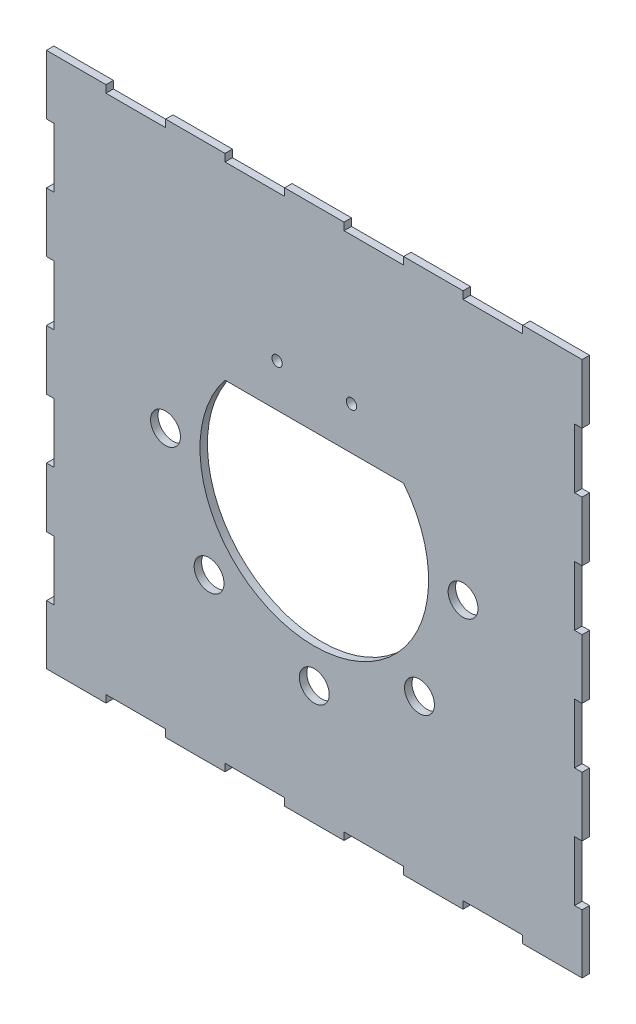
from build123d import *

# Parameters (mm, degrees)
SKETCH1_W           = 114.3
SKETCH1_H           = 114.3
BOSS_EXTRUDE1_DEPTH = 1.5875
CUT_EXTRUDE1_DEPTH  = 81.837894309
SKETCH4_R           = 3.1877
CUT_EXTRUDE2_DEPTH  = 81.837894309
SKETCH6_W           = 1.59004
SKETCH6_H           = 12.7254
SKETCH6_W_2         = 12.7254
SKETCH6_H_2         = 1.59004
CUT_EXTRUDE5_DEPTH  = 81.837894309
SKETCH7_OUTSIDE_W   = 148.63
SKETCH7_OUTSIDE_H   = 148.63
SKETCH7_OUTSIDE_R   = 1.1049
CUT_EXTRUDE6_DEPTH  = 81.837894309


with BuildPart() as part:
    # Sketch1 → Boss-Extrude1 (new body)
    with BuildSketch(Plane.XY):
        Rectangle(SKETCH1_W, SKETCH1_H)
    extrude(amount=BOSS_EXTRUDE1_DEPTH)

    # Sketch2 → Cut-Extrude1 (cut, through all)
    with BuildSketch(Plane.XY.offset(1.5875)):
        with BuildLine():
            Line((-19.05, 15.24), (19.05, 15.24))
            ThreePointArc((19.05, 15.24), (0, -24.395903345), (-19.05, 15.24))
        make_face()
    extrude(amount=-CUT_EXTRUDE1_DEPTH, mode=Mode.SUBTRACT)

    # Sketch4 → Cut-Extrude2 (cut, through all)
    with BuildSketch(Plane.XY.offset(1.5875)):
        with Locations((-31.75, 0)):
            Circle(SKETCH4_R)
        with Locations((-22.450640303, -22.450640303)):
            Circle(SKETCH4_R)
        with Locations((0, -31.75)):
            Circle(SKETCH4_R)
        with Locations((22.450640303, -22.450640303)):
            Circle(SKETCH4_R)
        with Locations((31.75, 0)):
            Circle(SKETCH4_R)
    extrude(amount=-CUT_EXTRUDE2_DEPTH, mode=Mode.SUBTRACT)

    # Sketch6 → Cut-Extrude5 (cut, through all)
    with BuildSketch(Plane.XY.offset(1.5875)):
        with Locations((-56.35498, 12.6619)):
            Rectangle(SKETCH6_W, SKETCH6_H)
        with Locations((-56.35498, 38.0873)):
            Rectangle(SKETCH6_W, SKETCH6_H)
        with Locations((-56.35498, -12.7635)):
            Rectangle(SKETCH6_W, SKETCH6_H)
        with Locations((-56.35498, -38.1889)):
            Rectangle(SKETCH6_W, SKETCH6_H)
        with Locations((56.35498, 12.6619)):
            Rectangle(SKETCH6_W, SKETCH6_H)
        with Locations((56.35498, 38.0873)):
            Rectangle(SKETCH6_W, SKETCH6_H)
        with Locations((56.35498, -12.7635)):
            Rectangle(SKETCH6_W, SKETCH6_H)
        with Locations((56.35498, -38.1889)):
            Rectangle(SKETCH6_W, SKETCH6_H)
        with Locations((-12.6873, 56.35498)):
            Rectangle(SKETCH6_W_2, SKETCH6_H_2)
        with Locations((-38.0873, 56.35498)):
            Rectangle(SKETCH6_W_2, SKETCH6_H_2)
        with Locations((12.7127, 56.35498)):
            Rectangle(SKETCH6_W_2, SKETCH6_H_2)
        with Locations((38.1127, 56.35498)):
            Rectangle(SKETCH6_W_2, SKETCH6_H_2)
        with Locations((-12.6873, -56.35498)):
            Rectangle(SKETCH6_W_2, SKETCH6_H_2)
        with Locations((-38.0873, -56.35498)):
            Rectangle(SKETCH6_W_2, SKETCH6_H_2)
        with Locations((12.7127, -56.35498)):
            Rectangle(SKETCH6_W_2, SKETCH6_H_2)
        with Locations((38.1127, -56.35498)):
            Rectangle(SKETCH6_W_2, SKETCH6_H_2)
    extrude(amount=-CUT_EXTRUDE5_DEPTH, mode=Mode.SUBTRACT)

    # Sketch7 outside → Cut-Extrude6 (cut, through all)
    # profile 1 of 3: a face of its own
    with BuildSketch(Plane.XY.offset(1.5875)):
        Rectangle(SKETCH7_OUTSIDE_W, SKETCH7_OUTSIDE_H)
        Polygon((-55.55996, 44.45), (-55.55996, 31.7246), (-57.15, 31.7246), (-57.15, 19.0246), (-55.55996, 19.0246), (-55.55996, 6.2992), (-57.15, 6.2992), (-57.15, -6.4008), (-55.55996, -6.4008), (-55.55996, -19.1262), (-57.15, -19.1262), (-57.15, -31.8262), (-55.55996, -31.8262), (-55.55996, -44.5516), (-57.15, -44.5516), (-57.15, -57.15), (-44.45, -57.15), (-44.45, -55.55996), (-31.7246, -55.55996), (-31.7246, -57.15), (-19.05, -57.15), (-19.05, -55.55996), (-6.3246, -55.55996), (-6.3246, -57.15), (6.35, -57.15), (6.35, -55.55996), (19.0754, -55.55996), (19.0754, -57.15), (31.75, -57.15), (31.75, -55.55996), (44.4754, -55.55996), (44.4754, -57.15), (57.15, -57.15), (57.15, -44.5516), (55.55996, -44.5516), (55.55996, -31.8262), (57.15, -31.8262), (57.15, -19.1262), (55.55996, -19.1262), (55.55996, -6.4008), (57.15, -6.4008), (57.15, 6.2992), (55.55996, 6.2992), (55.55996, 19.0246), (57.15, 19.0246), (57.15, 31.7246), (55.55996, 31.7246), (55.55996, 44.45), (57.15, 44.45), (57.15, 57.15), (44.4754, 57.15), (44.4754, 55.55996), (31.75, 55.55996), (31.75, 57.15), (19.0754, 57.15), (19.0754, 55.55996), (6.35, 55.55996), (6.35, 57.15), (-6.3246, 57.15), (-6.3246, 55.55996), (-19.05, 55.55996), (-19.05, 57.15), (-31.7246, 57.15), (-31.7246, 55.55996), (-44.45, 55.55996), (-44.45, 57.15), (-57.15, 57.15), (-57.15, 44.45), align=None, mode=Mode.SUBTRACT)
    # profile 2 of 3: a face of its own
    with BuildSketch(Plane.XY.offset(1.5875)):
        with Locations((-7.9375, 24.36749)):
            Circle(SKETCH7_OUTSIDE_R)
    # profile 3 of 3: a face of its own
    with BuildSketch(Plane.XY.offset(1.5875)):
        with Locations((7.9375, 24.36749)):
            Circle(SKETCH7_OUTSIDE_R)
    extrude(amount=-CUT_EXTRUDE6_DEPTH, mode=Mode.SUBTRACT)


solid = part.part
